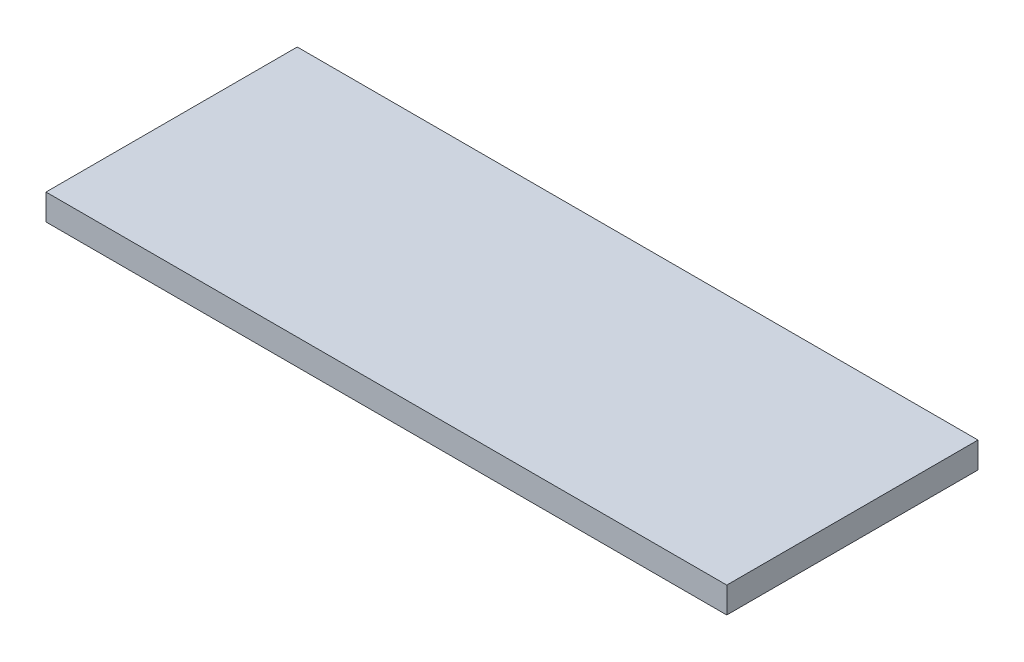
from build123d import *

# Parameters (mm, degrees)
SKETCH1_W           = 42
SKETCH1_H           = 15.5
BOSS_EXTRUDE1_DEPTH = 1.6


with BuildPart() as part:
    # Sketch1 → Boss-Extrude1 (new body)
    with BuildSketch(Plane(origin=(0, 0, 0), x_dir=(1, 0, 0), z_dir=(0, 1, 0))):
        with Locations((21, 7.75)):
            Rectangle(SKETCH1_W, SKETCH1_H)
    extrude(amount=BOSS_EXTRUDE1_DEPTH)


solid = part.part
